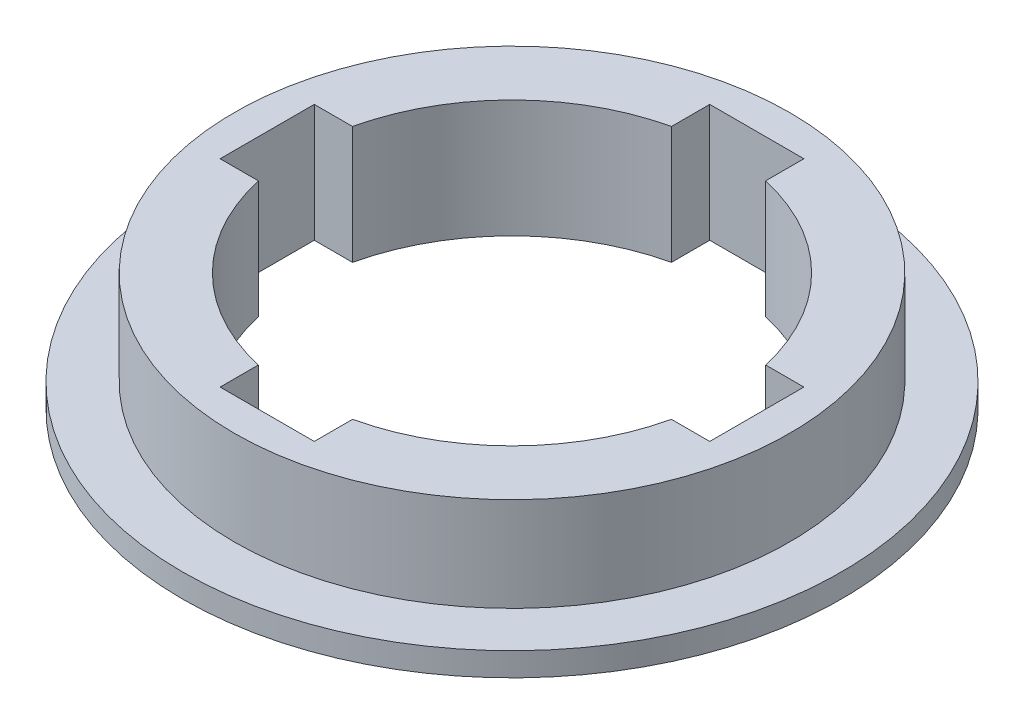
from build123d import *

# Parameters (mm, degrees)
SKETCH1_R           = 35
SKETCH1_R_2         = 22.5
BOSS_EXTRUDE1_DEPTH = 2.5
SKETCH2_R           = 29.5
SKETCH2_R_2         = 22.5
BOSS_EXTRUDE2_DEPTH = 10
CUT_EXTRUDE1_DEPTH  = 52.051444642


with BuildPart() as part:
    # Sketch1 → Boss-Extrude1 (new body)
    with BuildSketch(Plane(origin=(0, 0, 0), x_dir=(1, 0, 0), z_dir=(0, 1, 0))):
        Circle(SKETCH1_R)
        Circle(SKETCH1_R_2, mode=Mode.SUBTRACT)
    extrude(amount=BOSS_EXTRUDE1_DEPTH)

    # Sketch2 → Boss-Extrude2 (add)
    with BuildSketch(Plane(origin=(0, 2.5, 0), x_dir=(1, 0, 0), z_dir=(0, 1, 0))):
        Circle(SKETCH2_R)
        Circle(SKETCH2_R_2, mode=Mode.SUBTRACT)
    extrude(amount=BOSS_EXTRUDE2_DEPTH)

    # Sketch3 → Cut-Extrude1 (cut, through all)
    with BuildSketch(Plane(origin=(0, 12.5, 0), x_dir=(1, 0, 0), z_dir=(0, 1, 0))):
        with BuildLine():
            Line((-5, 21.937410968), (-5, 26))
            Line((-5, 26), (5, 26))
            Line((5, 26), (5, 21.937410968))
            ThreePointArc((5, 21.937410968), (15.909902577, 15.909902577), (21.937410968, 5))
            Line((21.937410968, 5), (26, 5))
            Line((26, 5), (26, -5))
            Line((26, -5), (21.937410968, -5))
            ThreePointArc((21.937410968, -5), (15.909902577, -15.909902577), (5, -21.937410968))
            Line((5, -21.937410968), (5, -26))
            Line((5, -26), (-5, -26))
            Line((-5, -26), (-5, -21.937410968))
            ThreePointArc((-5, -21.937410968), (-15.909902577, -15.909902577), (-21.937410968, -5))
            Line((-21.937410968, -5), (-26, -5))
            Line((-26, -5), (-26, 5))
            Line((-26, 5), (-21.937410968, 5))
            ThreePointArc((-21.937410968, 5), (-15.909902577, 15.909902577), (-5, 21.937410968))
        make_face()
    extrude(amount=-CUT_EXTRUDE1_DEPTH, mode=Mode.SUBTRACT)


solid = part.part
